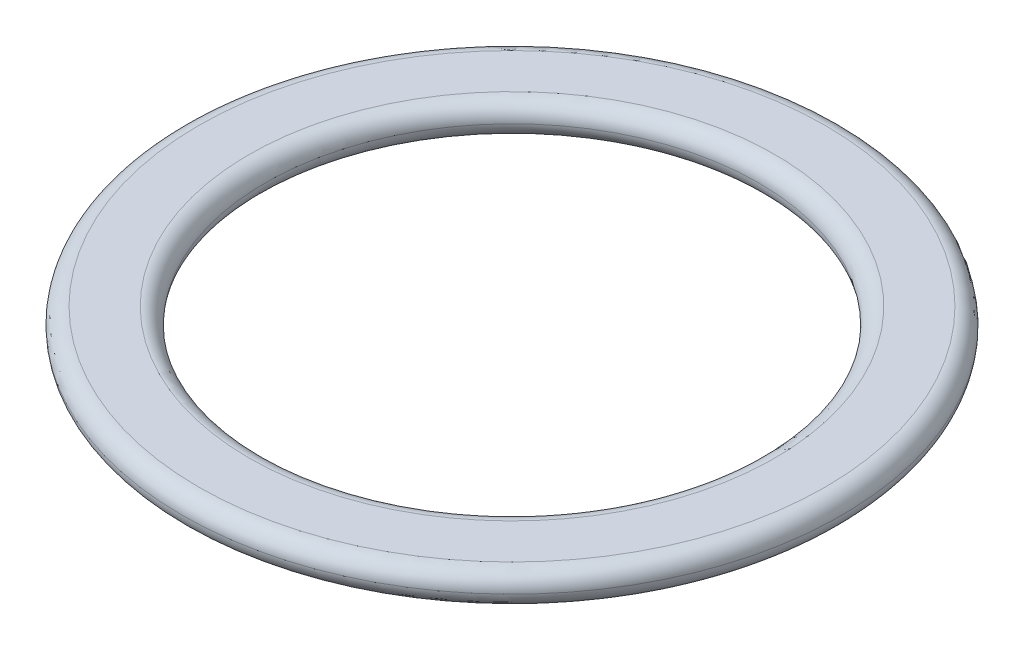
from build123d import *

# Parameters (mm, degrees)
SKETCH1_R               = 12.31
BOSS_EXTRUDE1_DEPTH     = 1.21
RADYUS1_R               = 0.61
RADYUS2_R               = 0.61
CUT_EXTRUDE1_DEPTH      = 1.21
CUT_EXTRUDE1_DEPTH_BACK = 11
SKETCH2_R               = 9.21
RADYUS3_R               = 0.61
RADYUS4_R               = 0.61


with BuildPart() as part:
    # Sketch1 → Boss-Extrude1 (new body)
    with BuildSketch(Plane(origin=(0, 0, 0), x_dir=(1, 0, 0), z_dir=(0, 1, 0))):
        with Locations(Location((0, 0, 0), (0, 0, 90))):
            Circle(SKETCH1_R)
    extrude(amount=BOSS_EXTRUDE1_DEPTH)

    # Radyus1
    radyus1_edges = [part.edges().sort_by_distance(p)[0] for p in [
        (0, 1.21, 12.31),
    ]]
    fillet(radyus1_edges, radius=RADYUS1_R)

    # Radyus2
    # the kernel refuses this fillet: 0.61 mm, written as the material it takes off along each edge
    with BuildSketch(Plane(origin=(0, 0, 0), x_dir=(0, 0, -1), z_dir=(1, 0, 0))) as radyus2_piece_1:
        with BuildLine():
            CenterArc((12.31 - RADYUS2_R, RADYUS2_R), RADYUS2_R, 270, 90)
            Line((12.31 - RADYUS2_R, 0), (12.31, 0))
            Line((12.31, 0), (12.31, RADYUS2_R))
        make_face()
    revolve(axis=Axis((0, 0, 0), (0, 1, 0)), mode=Mode.SUBTRACT)

    # Sketch2 → Cut-Extrude1 (cut, two sides: drawn at the far end of the back side and taken through both)
    with BuildSketch(Plane(origin=(0, 1.21, 0), x_dir=(1, 0, 0), z_dir=(0, 1, 0)).offset(-CUT_EXTRUDE1_DEPTH_BACK)):
        with Locations(Location((0, 0, 0), (0, 0, 270))):
            Circle(SKETCH2_R)
    extrude(amount=CUT_EXTRUDE1_DEPTH + CUT_EXTRUDE1_DEPTH_BACK, mode=Mode.SUBTRACT)

    # Radyus3
    radyus3_edges = [part.edges().sort_by_distance(p)[0] for p in [
        (0, 1.21, -9.21),
    ]]
    fillet(radyus3_edges, radius=RADYUS3_R)

    # Radyus4
    # the kernel refuses this fillet: 0.61 mm, written as the material it takes off along each edge
    with BuildSketch(Plane(origin=(0, 0, 0), x_dir=(0, 0, 1), z_dir=(-1, 0, 0))) as radyus4_piece_1:
        with BuildLine():
            CenterArc((9.21 + RADYUS4_R, RADYUS4_R), RADYUS4_R, 180, 90)
            Line((9.21 + RADYUS4_R, 0), (9.21, 0))
            Line((9.21, 0), (9.21, RADYUS4_R))
        make_face()
    revolve(axis=Axis((0, 0, 0), (0, 1, 0)), mode=Mode.SUBTRACT)


solid = part.part
